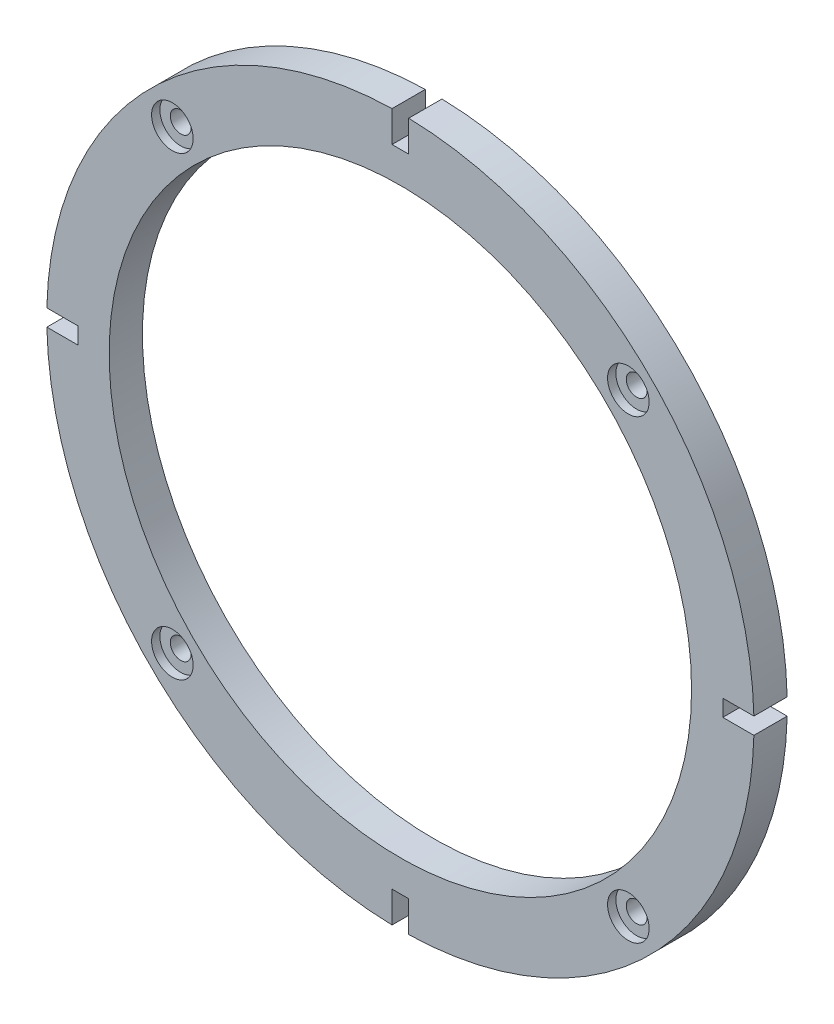
from build123d import *

# Parameters (mm, degrees)
SKETCH1_R           = 70
BOSS_EXTRUDE1_DEPTH = 8
SKETCH2_R           = 3.5
CUT_EXTRUDE1_DEPTH  = 3
SKETCH3_R           = 2.5
CUT_EXTRUDE2_DEPTH  = 14
SKETCH4_R           = 5
CUT_EXTRUDE3_DEPTH  = 2
BOSS_EXTRUDE2_START = 3
SKETCH5_R           = 3.5
SKETCH5_R_2         = 2.5
BOSS_EXTRUDE2_DEPTH = 3
CIRPATTERN1_COUNT   = 4


with BuildPart() as part:
    # Sketch1 → Boss-Extrude1 (new body)
    with BuildSketch(Plane.XY):
        with BuildLine():
            ThreePointArc((2, -84.976467331), (60.104076401, -60.104076401), (84.976467331, -2))
            Line((84.976467331, -2), (77.499555144, -2))
            Line((77.499555144, -2), (77.499555144, 2))
            Line((77.499555144, 2), (84.976467331, 2))
            ThreePointArc((84.976467331, 2), (60.104076401, 60.104076401), (2, 84.976467331))
            Line((2, 84.976467331), (2, 77.499555144))
            Line((2, 77.499555144), (-2, 77.499555144))
            Line((-2, 77.499555144), (-2, 84.976467331))
            ThreePointArc((-2, 84.976467331), (-60.104076401, 60.104076401), (-84.976467331, 2))
            Line((-84.976467331, 2), (-77.499555144, 2))
            Line((-77.499555144, 2), (-77.499555144, -2))
            Line((-77.499555144, -2), (-84.976467331, -2))
            ThreePointArc((-84.976467331, -2), (-60.104076401, -60.104076401), (-2, -84.976467331))
            Line((-2, -84.976467331), (-2, -77.499555144))
            Line((-2, -77.499555144), (2, -77.499555144))
            Line((2, -77.499555144), (2, -84.976467331))
        make_face()
        Circle(SKETCH1_R, mode=Mode.SUBTRACT)
    extrude(amount=BOSS_EXTRUDE1_DEPTH)

    # Sketch2 → Cut-Extrude1 (cut)
    with BuildSketch(Plane(origin=(0, 0, 0), x_dir=(-1, 0, 0), z_dir=(0, 0, -1))):
        with Locations((-54.800775542, 54.800775542)):
            Circle(SKETCH2_R)
        with Locations((54.800775542, 54.800775542)):
            Circle(SKETCH2_R)
        with Locations((54.800775542, -54.800775542)):
            Circle(SKETCH2_R)
        with Locations((-54.800775542, -54.800775542)):
            Circle(SKETCH2_R)
    extrude(amount=-CUT_EXTRUDE1_DEPTH, mode=Mode.SUBTRACT)

    # Sketch3 → Cut-Extrude2 (cut)
    with BuildSketch(Plane(origin=(0, 0, 0), x_dir=(-1, 0, 0), z_dir=(0, 0, -1))):
        with Locations((-54.800775542, 54.800775542)):
            Circle(SKETCH3_R)
        with Locations((54.800775542, 54.800775542)):
            Circle(SKETCH3_R)
        with Locations((54.800775542, -54.800775542)):
            Circle(SKETCH3_R)
        with Locations((-54.800775542, -54.800775542)):
            Circle(SKETCH3_R)
    extrude(amount=-CUT_EXTRUDE2_DEPTH, mode=Mode.SUBTRACT)

    # Sketch4 → Cut-Extrude3 (cut)
    with BuildSketch(Plane.XY.offset(8)):
        with Locations((-54.800775542, 54.800775542)):
            Circle(SKETCH4_R)
        with Locations((54.800775542, 54.800775542)):
            Circle(SKETCH4_R)
        with Locations((54.800775542, -54.800775542)):
            Circle(SKETCH4_R)
        with Locations((-54.800775542, -54.800775542)):
            Circle(SKETCH4_R)
    extrude(amount=-CUT_EXTRUDE3_DEPTH, mode=Mode.SUBTRACT)

    # Sketch5 → Boss-Extrude2 (add)
    with BuildSketch(Plane(origin=(0, 0, 3), x_dir=(-1, 0, 0), z_dir=(0, 0, -1)).offset(BOSS_EXTRUDE2_START)):
        with Locations((54.800775542, -54.800775542)):
            Circle(SKETCH5_R)
        with Locations((54.800775542, -54.800775542)):
            Circle(SKETCH5_R_2, mode=Mode.SUBTRACT)
    boss_extrude2 = extrude(amount=-BOSS_EXTRUDE2_DEPTH)

    # CirPattern1: Boss-Extrude2 ×4 about axis
    cirpattern1_axis = Axis((0, 0, 0), (0, 0, 1))
    for i in range(1, CIRPATTERN1_COUNT):
        add(boss_extrude2.rotate(cirpattern1_axis, i * 360 / CIRPATTERN1_COUNT))


solid = part.part
